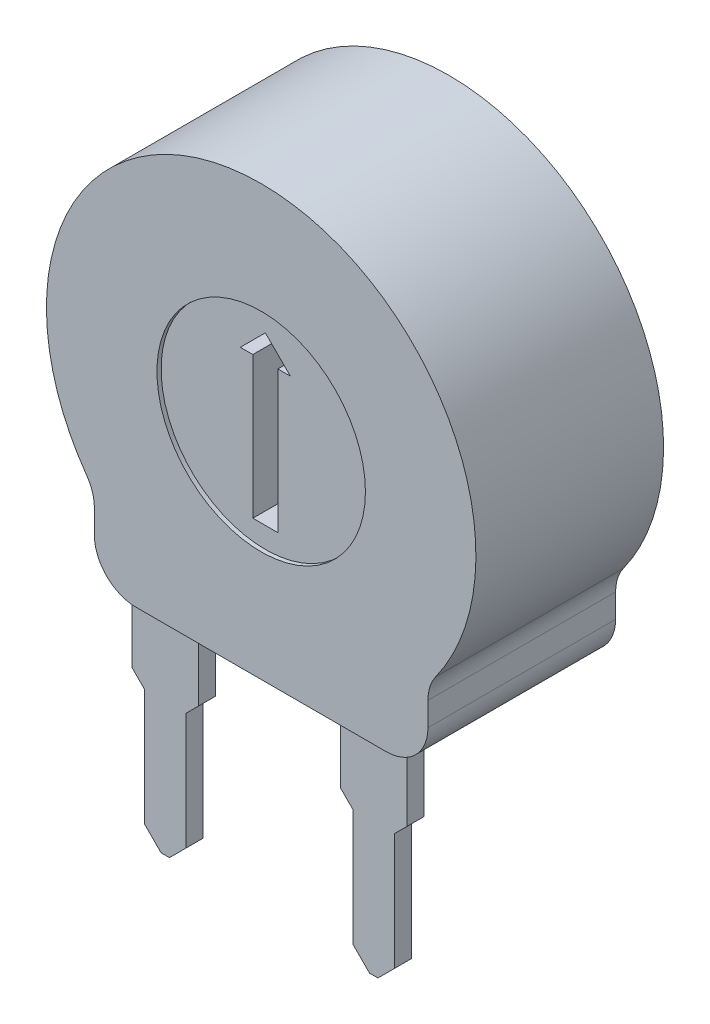
from build123d import *

# Parameters (mm, degrees)
BOSS_EXTRU_1_DEPTH      = 4.5
ESQUISSE2_W             = 1.6
ESQUISSE2_H             = 0.4
BOSS_EXTRU_2_DEPTH      = 1.5
ESQUISSE3_W             = 1
ESQUISSE3_H             = 0.4
BOSS_EXTRU_3_DEPTH      = 3.5
CHANFREIN1_SIZE         = 0.3
CHANFREIN2_SIZE         = 0.4
ESQUISSE4_R             = 2.5
ENL_V_MAT_EXTRU_1_DEPTH = 0.1
ENL_V_START             = -0.1
ESQUISSE5_R             = 2.5
ENL_V_MAT_EXTRU_2_DEPTH = 0.1
ENL_V_MAT_EXTRU_3_DEPTH = 13.202663644
CONG_1_R                = 1


# Some blends are built 0.0001 mm under size
with BuildPart() as part:
    # Esquisse1 → Boss.-Extru.1 (new body)
    with BuildSketch(Plane.XY):
        with BuildLine():
            Line((-4, -3.243840317), (-4, -5.15))
            Line((-4, -5.15), (4, -5.15))
            Line((4, -5.15), (4, -3.243840317))
            ThreePointArc((4, -3.243840317), (0, 5.15), (-4, -3.243840317))
        make_face()
    extrude(amount=BOSS_EXTRU_1_DEPTH)

    # Esquisse2 → Boss.-Extru.2 (add)
    with BuildSketch(Plane.XZ.offset(5.15)):
        with Locations((-2.5, 4.1)):
            Rectangle(ESQUISSE2_W, ESQUISSE2_H)
        with Locations((2.5, 4.1)):
            Rectangle(ESQUISSE2_W, ESQUISSE2_H)
        with Locations((0, 1.6)):
            Rectangle(ESQUISSE2_W, ESQUISSE2_H)
    extrude(amount=BOSS_EXTRU_2_DEPTH)

    # Esquisse3 → Boss.-Extru.3 (add)
    with BuildSketch(Plane.XZ.offset(6.65)):
        with Locations((-2.5, 4.1)):
            Rectangle(ESQUISSE3_W, ESQUISSE3_H)
        with Locations((2.5, 4.1)):
            Rectangle(ESQUISSE3_W, ESQUISSE3_H)
        with Locations((0, 1.6)):
            Rectangle(ESQUISSE3_W, ESQUISSE3_H)
    extrude(amount=BOSS_EXTRU_3_DEPTH)

    # Chanfrein1
    chanfrein1_edges = [part.edges().sort_by_distance(p)[0] for p in [
        (3, -6.65, 4.1),
        (-2, -6.65, 4.1),
        (0.5, -6.65, 1.6),
        (-0.5, -6.65, 1.6),
        (2, -6.65, 4.1),
        (-3, -6.65, 4.1),
    ]]
    chamfer(chanfrein1_edges, length=CHANFREIN1_SIZE - 0.0001)  # a hair under: the kernel refuses the full size

    # Chanfrein2
    chanfrein2_edges = [part.edges().sort_by_distance(p)[0] for p in [
        (-3, -10.15, 4.1),
        (-2, -10.15, 4.1),
        (2, -10.15, 4.1),
        (3, -10.15, 4.1),
        (-0.5, -10.15, 1.6),
        (0.5, -10.15, 1.6),
    ]]
    chamfer(chanfrein2_edges, length=CHANFREIN2_SIZE)

    # Esquisse4 → Enlèv. mat.-Extru.1 (cut)
    with BuildSketch(Plane(origin=(0, 0, 0), x_dir=(-1, 0, 0), z_dir=(0, 0, -1))):
        Circle(ESQUISSE4_R)
    extrude(amount=-ENL_V_MAT_EXTRU_1_DEPTH, mode=Mode.SUBTRACT)

    # Esquisse5 → Enlèv. mat.-Extru.2 (cut)
    with BuildSketch(Plane.XY.offset(4.5).offset(ENL_V_START)):
        with Locations(Location((0, 0, 0), (0, 0, 180))):
            Circle(ESQUISSE5_R)
    extrude(amount=ENL_V_MAT_EXTRU_2_DEPTH, mode=Mode.SUBTRACT)

    # Esquisse6 → Enlèv. mat.-Extru.3 (cut, through all)
    with BuildSketch(Plane(origin=(0, 0, 0.1), x_dir=(-1, 0, 0), z_dir=(0, 0, -1))):
        Polygon((0, 2), (-0.6, 1.4), (-0.3, 1.4), (-0.3, -2), (0.3, -2), (0.3, 1.4), (0.6, 1.4), align=None)
    extrude(amount=-ENL_V_MAT_EXTRU_3_DEPTH, mode=Mode.SUBTRACT)

    # Congé1
    # the kernel refuses this fillet: 1 mm, written as the material it adds along each edge
    with BuildSketch(Plane(origin=(-4, -3.243840317, 0), x_dir=(0, -1, 0), z_dir=(0, 0, 1))) as cong_1_piece_1:
        with BuildLine():
            CenterArc((0.337011537, -1), CONG_1_R, 90, 35.609116242)
            ThreePointArc((-0.245240797, -0.18699187), (-0.12122038, -0.095332066), (0, 0))
            Line((0, 0), (0.337011537, 0))
        make_face()
    extrude(amount=4.5)
    with BuildSketch(Plane(origin=(4, -3.243840317, 0), x_dir=(0, -1, 0), z_dir=(0, 0, 1))) as cong_1_piece_2:
        with BuildLine():
            CenterArc((0.337011537, 1), CONG_1_R, 234.390883758, 35.609116242)
            ThreePointArc((-0.245240797, 0.18699187), (-0.12122038, 0.095332066), (0, 0))
            Line((0, 0), (0.337011537, 0))
        make_face()
    extrude(amount=4.5)
    # the kernel refuses this fillet: 1 mm, written as the material it takes off along each edge
    with BuildSketch(Plane(origin=(-4, -5.15, -2.5), x_dir=(1, 0, 0), z_dir=(0, 0, 1))) as cong_1_2_piece_1_section:
        with BuildLine():
            CenterArc((CONG_1_R, CONG_1_R), CONG_1_R, 180, 90)
            Line((0, CONG_1_R), (0, 0))
            Line((0, 0), (CONG_1_R, 0))
        make_face()
    cong_1_2_piece_1 = extrude(amount=9.5, mode=Mode.PRIVATE)
    cong_1_2_piece_1 = split(cong_1_2_piece_1, bisect_by=Plane(origin=(-3.3, -5.149735602, 0.7), z_dir=(1, 0, 0)), keep=Keep.TOP, mode=Mode.PRIVATE)
    cong_1_2_piece_1 = split(cong_1_2_piece_1, bisect_by=Plane(origin=(-3.182548732, -5.149735602, 3.9), z_dir=(0, 0, -1)), keep=Keep.TOP, mode=Mode.PRIVATE)
    add(cong_1_2_piece_1, mode=Mode.SUBTRACT)
    with BuildSketch(Plane(origin=(-4, -5.15, -2.5), x_dir=(1, 0, 0), z_dir=(0, 0, 1))) as cong_1_2_piece_2_section:
        with BuildLine():
            CenterArc((CONG_1_R, CONG_1_R), CONG_1_R, 180, 90)
            Line((0, CONG_1_R), (0, 0))
            Line((0, 0), (CONG_1_R, 0))
        make_face()
    cong_1_2_piece_2 = extrude(amount=9.5, mode=Mode.PRIVATE)
    cong_1_2_piece_2 = split(cong_1_2_piece_2, bisect_by=Plane(origin=(-3.3, -4.913833239, 0.7), z_dir=(-1, 0, 0)), keep=Keep.TOP, mode=Mode.PRIVATE)
    cong_1_2_piece_2 = split(cong_1_2_piece_2, bisect_by=Plane(origin=(-3.799145829, -4.913833239, 3.9), z_dir=(0, 0, -1)), keep=Keep.TOP, mode=Mode.PRIVATE)
    add(cong_1_2_piece_2, mode=Mode.SUBTRACT)
    with BuildSketch(Plane(origin=(-4, -5.15, -2.5), x_dir=(1, 0, 0), z_dir=(0, 0, 1))) as cong_1_2_piece_3_section:
        with BuildLine():
            CenterArc((CONG_1_R, CONG_1_R), CONG_1_R, 180, 90)
            Line((0, CONG_1_R), (0, 0))
            Line((0, 0), (CONG_1_R, 0))
        make_face()
    cong_1_2_piece_3 = extrude(amount=9.5, mode=Mode.PRIVATE)
    cong_1_2_piece_3 = split(cong_1_2_piece_3, bisect_by=Plane(origin=(-3.799145829, -4.913833239, 4.3), z_dir=(0, 0, -1)), keep=Keep.TOP, mode=Mode.PRIVATE)
    cong_1_2_piece_3 = split(cong_1_2_piece_3, bisect_by=Plane(origin=(-3.3, -4.913833239, 4.1), z_dir=(-1, 0, 0)), keep=Keep.TOP, mode=Mode.PRIVATE)
    cong_1_2_piece_3 = split(cong_1_2_piece_3, bisect_by=Plane(origin=(-3.799145829, -4.913833239, 3.9), z_dir=(0, 0, 1)), keep=Keep.TOP, mode=Mode.PRIVATE)
    add(cong_1_2_piece_3, mode=Mode.SUBTRACT)
    with BuildSketch(Plane(origin=(-4, -5.15, -2.5), x_dir=(1, 0, 0), z_dir=(0, 0, 1))) as cong_1_2_piece_4_section:
        with BuildLine():
            CenterArc((CONG_1_R, CONG_1_R), CONG_1_R, 180, 90)
            Line((0, CONG_1_R), (0, 0))
            Line((0, 0), (CONG_1_R, 0))
        make_face()
    cong_1_2_piece_4 = extrude(amount=9.5, mode=Mode.PRIVATE)
    cong_1_2_piece_4 = split(cong_1_2_piece_4, bisect_by=Plane(origin=(-3.182548732, -5.149735602, 4.3), z_dir=(0, 0, 1)), keep=Keep.TOP, mode=Mode.PRIVATE)
    cong_1_2_piece_4 = split(cong_1_2_piece_4, bisect_by=Plane(origin=(-3.3, -5.149735602, 5.65), z_dir=(1, 0, 0)), keep=Keep.TOP, mode=Mode.PRIVATE)
    add(cong_1_2_piece_4, mode=Mode.SUBTRACT)
    with BuildSketch(Plane(origin=(-4, -5.15, -2.5), x_dir=(1, 0, 0), z_dir=(0, 0, 1))) as cong_1_2_piece_5_section:
        with BuildLine():
            CenterArc((CONG_1_R, CONG_1_R), CONG_1_R, 180, 90)
            Line((0, CONG_1_R), (0, 0))
            Line((0, 0), (CONG_1_R, 0))
        make_face()
    cong_1_2_piece_5 = extrude(amount=9.5, mode=Mode.PRIVATE)
    cong_1_2_piece_5 = split(cong_1_2_piece_5, bisect_by=Plane(origin=(-3.799145829, -4.913833239, 4.3), z_dir=(0, 0, 1)), keep=Keep.TOP, mode=Mode.PRIVATE)
    cong_1_2_piece_5 = split(cong_1_2_piece_5, bisect_by=Plane(origin=(-3.3, -4.913833239, 5.65), z_dir=(-1, 0, 0)), keep=Keep.TOP, mode=Mode.PRIVATE)
    add(cong_1_2_piece_5, mode=Mode.SUBTRACT)
    with BuildSketch(Plane(origin=(4, -5.15, -2.5), x_dir=(-1, 0, 0), z_dir=(0, 0, 1))) as cong_1_2_piece_6_section:
        with BuildLine():
            CenterArc((CONG_1_R, -CONG_1_R), CONG_1_R, 90, 90)
            Line((0, -CONG_1_R), (0, 0))
            Line((0, 0), (CONG_1_R, 0))
        make_face()
    cong_1_2_piece_6 = extrude(amount=9.5, mode=Mode.PRIVATE)
    cong_1_2_piece_6 = split(cong_1_2_piece_6, bisect_by=Plane(origin=(3.3, -5.149735602, 0.7), z_dir=(-1, 0, 0)), keep=Keep.TOP, mode=Mode.PRIVATE)
    cong_1_2_piece_6 = split(cong_1_2_piece_6, bisect_by=Plane(origin=(3.182548732, -5.149735602, 3.9), z_dir=(0, 0, -1)), keep=Keep.TOP, mode=Mode.PRIVATE)
    add(cong_1_2_piece_6, mode=Mode.SUBTRACT)
    with BuildSketch(Plane(origin=(4, -5.15, -2.5), x_dir=(-1, 0, 0), z_dir=(0, 0, 1))) as cong_1_2_piece_7_section:
        with BuildLine():
            CenterArc((CONG_1_R, -CONG_1_R), CONG_1_R, 90, 90)
            Line((0, -CONG_1_R), (0, 0))
            Line((0, 0), (CONG_1_R, 0))
        make_face()
    cong_1_2_piece_7 = extrude(amount=9.5, mode=Mode.PRIVATE)
    cong_1_2_piece_7 = split(cong_1_2_piece_7, bisect_by=Plane(origin=(3.3, -4.913833239, 0.7), z_dir=(1, 0, 0)), keep=Keep.TOP, mode=Mode.PRIVATE)
    cong_1_2_piece_7 = split(cong_1_2_piece_7, bisect_by=Plane(origin=(3.799145829, -4.913833239, 3.9), z_dir=(0, 0, -1)), keep=Keep.TOP, mode=Mode.PRIVATE)
    add(cong_1_2_piece_7, mode=Mode.SUBTRACT)
    with BuildSketch(Plane(origin=(4, -5.15, -2.5), x_dir=(-1, 0, 0), z_dir=(0, 0, 1))) as cong_1_2_piece_8_section:
        with BuildLine():
            CenterArc((CONG_1_R, -CONG_1_R), CONG_1_R, 90, 90)
            Line((0, -CONG_1_R), (0, 0))
            Line((0, 0), (CONG_1_R, 0))
        make_face()
    cong_1_2_piece_8 = extrude(amount=9.5, mode=Mode.PRIVATE)
    cong_1_2_piece_8 = split(cong_1_2_piece_8, bisect_by=Plane(origin=(3.799145829, -4.913833239, 4.3), z_dir=(0, 0, -1)), keep=Keep.TOP, mode=Mode.PRIVATE)
    cong_1_2_piece_8 = split(cong_1_2_piece_8, bisect_by=Plane(origin=(3.3, -4.913833239, 4.1), z_dir=(1, 0, 0)), keep=Keep.TOP, mode=Mode.PRIVATE)
    cong_1_2_piece_8 = split(cong_1_2_piece_8, bisect_by=Plane(origin=(3.799145829, -4.913833239, 3.9), z_dir=(0, 0, 1)), keep=Keep.TOP, mode=Mode.PRIVATE)
    add(cong_1_2_piece_8, mode=Mode.SUBTRACT)
    with BuildSketch(Plane(origin=(4, -5.15, -2.5), x_dir=(-1, 0, 0), z_dir=(0, 0, 1))) as cong_1_2_piece_9_section:
        with BuildLine():
            CenterArc((CONG_1_R, -CONG_1_R), CONG_1_R, 90, 90)
            Line((0, -CONG_1_R), (0, 0))
            Line((0, 0), (CONG_1_R, 0))
        make_face()
    cong_1_2_piece_9 = extrude(amount=9.5, mode=Mode.PRIVATE)
    cong_1_2_piece_9 = split(cong_1_2_piece_9, bisect_by=Plane(origin=(3.182548732, -5.149735602, 4.3), z_dir=(0, 0, 1)), keep=Keep.TOP, mode=Mode.PRIVATE)
    cong_1_2_piece_9 = split(cong_1_2_piece_9, bisect_by=Plane(origin=(3.3, -5.149735602, 5.65), z_dir=(-1, 0, 0)), keep=Keep.TOP, mode=Mode.PRIVATE)
    add(cong_1_2_piece_9, mode=Mode.SUBTRACT)
    with BuildSketch(Plane(origin=(4, -5.15, -2.5), x_dir=(-1, 0, 0), z_dir=(0, 0, 1))) as cong_1_2_piece_10_section:
        with BuildLine():
            CenterArc((CONG_1_R, -CONG_1_R), CONG_1_R, 90, 90)
            Line((0, -CONG_1_R), (0, 0))
            Line((0, 0), (CONG_1_R, 0))
        make_face()
    cong_1_2_piece_10 = extrude(amount=9.5, mode=Mode.PRIVATE)
    cong_1_2_piece_10 = split(cong_1_2_piece_10, bisect_by=Plane(origin=(3.799145829, -4.913833239, 4.3), z_dir=(0, 0, 1)), keep=Keep.TOP, mode=Mode.PRIVATE)
    cong_1_2_piece_10 = split(cong_1_2_piece_10, bisect_by=Plane(origin=(3.3, -4.913833239, 5.65), z_dir=(1, 0, 0)), keep=Keep.TOP, mode=Mode.PRIVATE)
    add(cong_1_2_piece_10, mode=Mode.SUBTRACT)


solid = part.part
